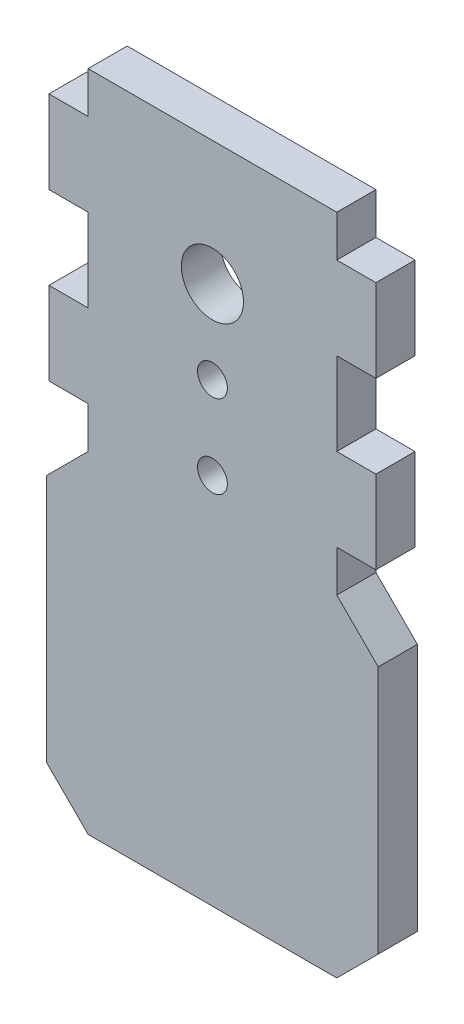
from build123d import *

# Parameters (mm, degrees)
BOSS_EXTRUDE1_DEPTH = 5.9944
SKETCH2_R           = 4.7625
CUT_EXTRUDE1_DEPTH  = 68.534353797
SKETCH3_R           = 2.286
CUT_EXTRUDE2_DEPTH  = 68.534353797
SKETCH4_W           = 50.8
SKETCH4_H           = 50.8
BOSS_EXTRUDE2_DEPTH = 5.9944
CHAMFER1_SIZE       = 6.35


with BuildPart() as part:
    # Sketch1 → Boss-Extrude1 (new body)
    with BuildSketch(Plane.XY):
        Polygon((0, 0), (-38.1, 0), (-38.1, 6.35), (-44.0944, 6.35), (-44.0944, 19.05), (-38.1, 19.05), (-38.1, 31.75), (-44.0944, 31.75), (-44.0944, 44.45), (-38.1, 44.45), (-38.1, 50.8), (0, 50.8), (0, 44.45), (5.9944, 44.45), (5.9944, 31.75), (0, 31.75), (0, 19.05), (5.9944, 19.05), (5.9944, 6.35), (0, 6.35), align=None)
    extrude(amount=BOSS_EXTRUDE1_DEPTH)

    # Sketch2 → Cut-Extrude1 (cut, through all)
    with BuildSketch(Plane(origin=(0, 0, 0), x_dir=(-1, 0, 0), z_dir=(0, 0, -1))):
        with Locations((19.05, 31.75)):
            Circle(SKETCH2_R)
    extrude(amount=-CUT_EXTRUDE1_DEPTH, mode=Mode.SUBTRACT)

    # Sketch3 → Cut-Extrude2 (cut, through all)
    with BuildSketch(Plane.XY.offset(5.9944)):
        with Locations((-19.05, 19.05)):
            Circle(SKETCH3_R)
        with Locations((-19.05, 6.35)):
            Circle(SKETCH3_R)
    extrude(amount=-CUT_EXTRUDE2_DEPTH, mode=Mode.SUBTRACT)

    # Sketch4 → Boss-Extrude2 (add)
    with BuildSketch(Plane.XY.offset(5.9944)):
        with Locations((-19.05, -25.4)):
            Rectangle(SKETCH4_W, SKETCH4_H)
    extrude(amount=-BOSS_EXTRUDE2_DEPTH)

    # Chamfer1
    chamfer1_edges = [part.edges().sort_by_distance(p)[0] for p in [
        (6.35, 0, 2.9972),
        (6.35, -50.8, 2.9972),
        (-44.45, -50.8, 2.9972),
        (-44.45, 0, 2.9972),
    ]]
    chamfer(chamfer1_edges, length=CHAMFER1_SIZE - 0.0001)  # a hair under: the kernel refuses the full size


solid = part.part
